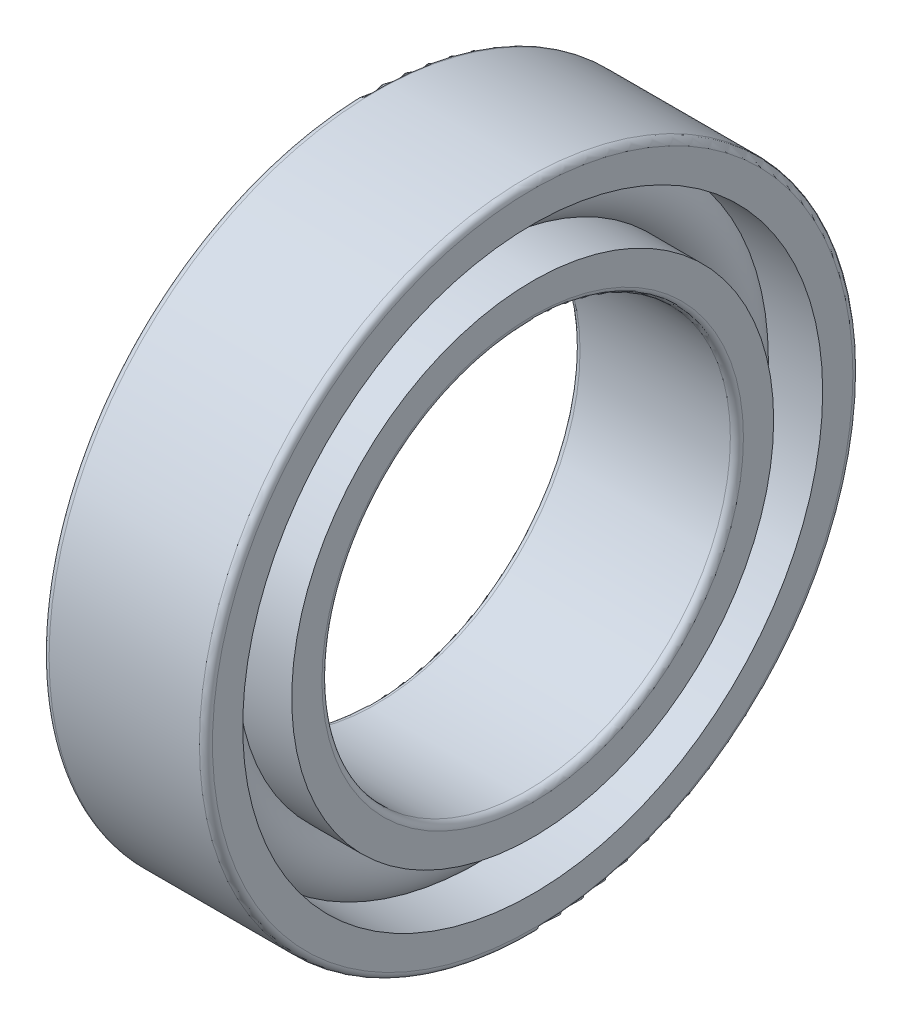
from build123d import *

# Parameters (mm, degrees)
CAGSPISKE_W     = 0.09
CAGSPISKE_H     = 0.15
CAGESPINE_ANGLE = 0.001
BALSIMSKE_R     = 0.45


with BuildPart() as part:
    # CagSpiSke → CageSpine (revolve)
    with BuildSketch(Plane.XY):
        with Locations((0, 3.25)):
            Rectangle(CAGSPISKE_W, CAGSPISKE_H)
    revolve(axis=Axis((-20.6375, 0, 0), (-1, 0, 0)), revolution_arc=CAGESPINE_ANGLE)

    # BalSimSke → BallsSimplified (revolve)
    with BuildSketch(Plane.XY):
        with Locations((0, 3.25)):
            Circle(BALSIMSKE_R)
    revolve(axis=Axis((-10, 0, 0), (1, 0, 0)))

    # InnRacSke → InnerRace (revolve)
    with BuildSketch(Plane.XY):
        with BuildLine():
            Line((-0.301039864, 2.95), (-1, 2.95))
            Line((-1, 2.95), (-1, 2.58))
            ThreePointArc((-1, 2.58), (-0.976568542, 2.523431458), (-0.92, 2.5))
            Line((-0.92, 2.5), (0.92, 2.5))
            ThreePointArc((0.92, 2.5), (0.976568542, 2.523431458), (1, 2.58))
            Line((1, 2.58), (1, 2.95))
            Line((1, 2.95), (0.301039864, 2.95))
            ThreePointArc((0.301039864, 2.95), (0, 2.825), (-0.301039864, 2.95))
        make_face()
    revolve(axis=Axis((-20.6375, 0, 0), (1, 0, 0)))

    # OutRacSke → OuterRace (revolve)
    with BuildSketch(Plane.XY):
        with BuildLine():
            Line((-0.301039864, 3.55), (-1, 3.55))
            Line((-1, 3.55), (-1, 3.92))
            ThreePointArc((-1, 3.92), (-0.976568542, 3.976568542), (-0.92, 4))
            Line((-0.92, 4), (0.92, 4))
            ThreePointArc((0.92, 4), (0.976568542, 3.976568542), (1, 3.92))
            Line((1, 3.92), (1, 3.55))
            Line((1, 3.55), (0.301039864, 3.55))
            ThreePointArc((0.301039864, 3.55), (0, 3.675), (-0.301039864, 3.55))
        make_face()
    revolve(axis=Axis((-20.6375, 0, 0), (1, 0, 0)))


solid = part.part
